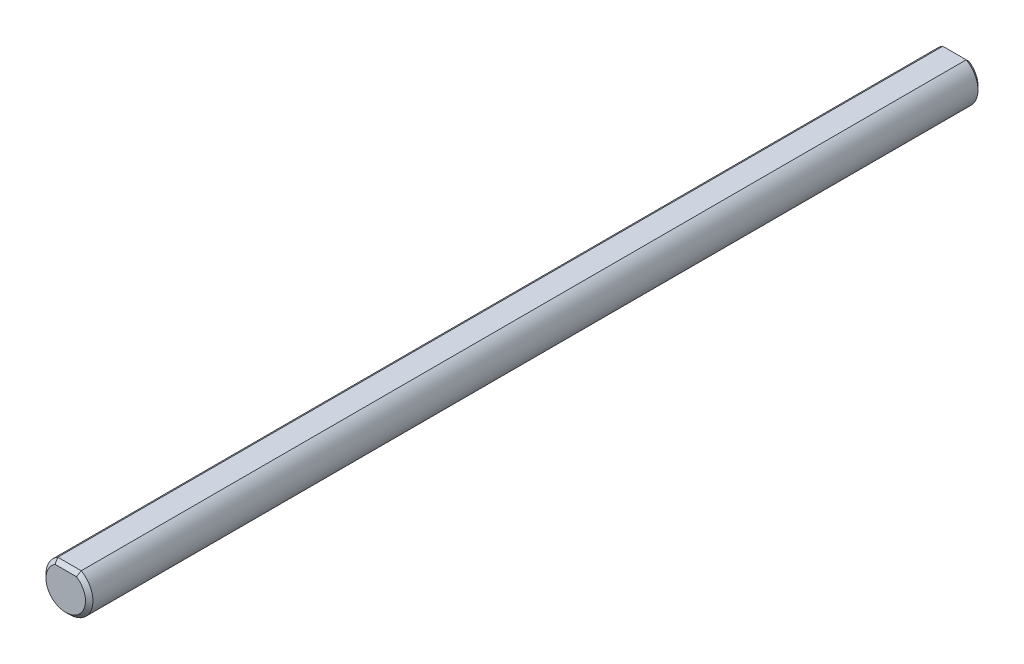
from build123d import *

# Parameters (mm, degrees)
BOSS_EXTRUDE1_DEPTH = 120.65
CHAMFER1_SIZE       = 0.508


with BuildPart() as part:
    # Sketch1 → Boss-Extrude1 (new body)
    with BuildSketch(Plane.XY):
        with BuildLine():
            Line((-1.5875, 2.749630657), (1.5875, 2.749630657))
            ThreePointArc((1.5875, 2.749630657), (0, -3.175), (-1.5875, 2.749630657))
        make_face()
    extrude(amount=BOSS_EXTRUDE1_DEPTH)

    # Chamfer1
    # the kernel refuses this chamfer: 0.508 mm, written as the material it takes off along each edge
    with BuildSketch(Plane(origin=(-2.893914958, 2.749630657, 0), x_dir=(0, 0.027495876610586435, 0.9996219169112968), z_dir=(1, 0, 0))) as chamfer1_piece_1:
        Polygon((CHAMFER1_SIZE * 0.999621916911, CHAMFER1_SIZE * 0.0274958766106), (-CHAMFER1_SIZE * 0.0274958766106, CHAMFER1_SIZE * 0.999621916911), (0, 0), align=None)
    extrude(amount=5.787829916, mode=Mode.SUBTRACT)
    with BuildSketch(Plane(origin=(0, 0, 0), x_dir=(0.11006425826792274, 0.9939244735149306, 0), z_dir=(-0.9939244735149306, 0.11006425826792274, 0))) as chamfer1_piece_2:
        Polygon((3.175, -CHAMFER1_SIZE), (3.175 - CHAMFER1_SIZE, 0), (3.175, 0), align=None)
    revolve(axis=Axis((0, 0, 0), (0, 0, -1)), revolution_arc=347.361960422, mode=Mode.SUBTRACT)
    with BuildSketch(Plane(origin=(0, 0, 120.65), x_dir=(0.11006425826792288, 0.9939244735149306, 0), z_dir=(-0.9939244735149306, 0.11006425826792288, 0))) as chamfer1_piece_3:
        Polygon((3.175, CHAMFER1_SIZE), (3.175 - CHAMFER1_SIZE, 0), (3.175, 0), align=None)
    revolve(axis=Axis((0, 0, 120.65), (0, 0, -1)), revolution_arc=347.361960422, mode=Mode.SUBTRACT)
    with BuildSketch(Plane(origin=(-2.893914958, 2.749630657, 120.65), x_dir=(0, 0.027495876610587017, -0.9996219169112968), z_dir=(1, 0, 0))) as chamfer1_piece_4:
        Polygon((CHAMFER1_SIZE * 0.999621916911, -CHAMFER1_SIZE * 0.0274958766106), (-CHAMFER1_SIZE * 0.0274958766106, -CHAMFER1_SIZE * 0.999621916911), (0, 0), align=None)
    extrude(amount=5.787829916, mode=Mode.SUBTRACT)


solid = part.part
